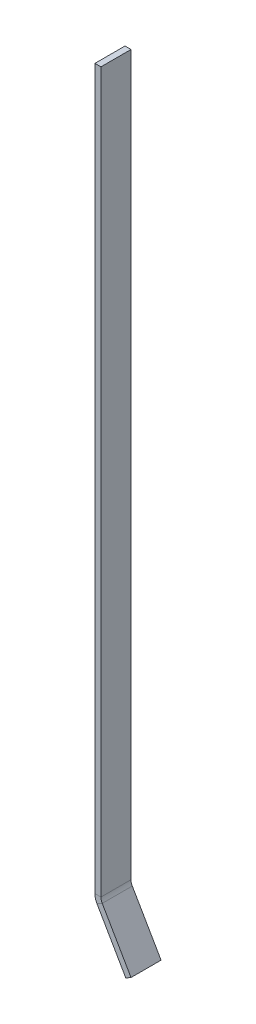
from build123d import *

# Parameters (mm, degrees)
BASE_FLANGE1_DEPTH = 25


# Sheet-metal steps are written as plain solids
with BuildPart() as part:
    # Sketch1 → Base-Flange1 (new body)
    with BuildSketch(Plane.XY):
        with BuildLine():
            Line((0, 0), (0, -597.856406461))
            ThreePointArc((0, -597.856406461), (0.27259339, -599.926958821), (1.07179677, -601.856406461))
            Line((1.07179677, -601.856406461), (25, -643.301270189))
            Line((25, -643.301270189), (20.669872981, -645.801270189))
            Line((20.669872981, -645.801270189), (-3.258330249, -604.356406461))
            ThreePointArc((-3.258330249, -604.356406461), (-4.557035742, -601.221054047), (-5, -597.856406461))
            Line((-5, -597.856406461), (-5, 0))
            Line((-5, 0), (0, 0))
        make_face()
    extrude(amount=BASE_FLANGE1_DEPTH)


solid = part.part
